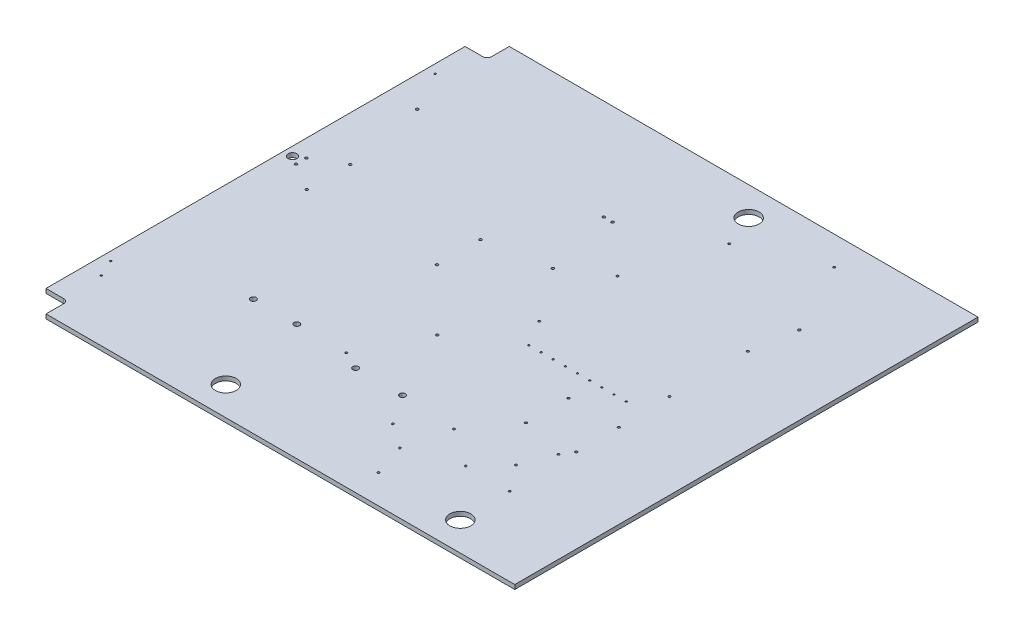
from build123d import *

# Parameters (mm, degrees)
SKETCH1_W                                   = 533.4
SKETCH1_H                                   = 5
BOSS_EXTRUDE1_DEPTH                         = 565.15
BOTTHOMHOLES_SKETCH2_R                      = 12
BOTTOMSTEPPERHOLES_CUT_EXTRUDE1_DEPTH       = 778.132602906
BOTTOMPSUHOLESSKETCH2_R                     = 1.5
BOTTOMPSUHOLESSKETCH2_R_2                   = 3.25
BOTTOMPSUHOLESCUT_EXTRUDE1_DEPTH            = 778.132602906
OCTOPUSHOLESSKETCH2_R                       = 1.35
OCTOPUSMOUNTHOLESCUT_EXTRUDE1_DEPTH         = 778.132602906
POWRCABLEGUIDEMOUNTHOLESSKETCH2_R           = 1.5
POWERCABLEGUIDEMOUNTHOLESCUT_EXTRUDE1_DEPTH = 778.132602906
RPIHOLESSKETCH2_R                           = 1.35
RPIMOUNTHOLESCUT_EXTRUDE1_DEPTH             = 778.132602906
CABLEHOLESSKETCH2_R                         = 1.5
CABLEHOLESSKETCH2_R_2                       = 5
CABLEHOLESSKETCH2_R_3                       = 1
CABLEHOLESCUT_EXTRUDE1_DEPTH                = 778.132602906
SKETCH2_R                                   = 1
OCTOPUSROUTING_HOLESCUT_EXTRUDE1_DEPTH      = 778.132602906
SKETCH3_R                                   = 1.25
CORNERCLAMPHOLECUTS_EXTRUDE1_DEPTH          = 778.132602906
CORNERCABLEKNOTCHCUT_EXTRUDE1_DEPTH         = 778.132602906


with BuildPart() as part:
    # Sketch1 → Boss-Extrude1 (new body)
    with BuildSketch(Plane(origin=(0, 0, 0), x_dir=(0, 0, -1), z_dir=(1, 0, 0))):
        with Locations((-266.7, 2.5)):
            Rectangle(SKETCH1_W, SKETCH1_H)
    extrude(amount=BOSS_EXTRUDE1_DEPTH)

    # BotthomHoles-Sketch2 → BottomStepperHoles-Cut-Extrude1 (cut, through all)
    with BuildSketch(Plane(origin=(0, 5, 0), x_dir=(1, 0, 0), z_dir=(0, 1, 0))):
        with Locations((334.275, -33.175)):
            Circle(BOTTHOMHOLES_SKETCH2_R)
        with Locations((199.275, -500.225)):
            Circle(BOTTHOMHOLES_SKETCH2_R)
        with Locations((469.275, -500.225)):
            Circle(BOTTHOMHOLES_SKETCH2_R)
    extrude(amount=-BOTTOMSTEPPERHOLES_CUT_EXTRUDE1_DEPTH, mode=Mode.SUBTRACT)

    # BottomPSUHolesSketch2 → BottomPSUHolesCut-Extrude1 (cut, through all)
    with BuildSketch(Plane(origin=(0, 5, 0), x_dir=(1, 0, 0), z_dir=(0, 1, 0))):
        with Locations((201.5, -209.2)):
            Circle(BOTTOMPSUHOLESSKETCH2_R)
        with Locations((201.5, -259.2)):
            Circle(BOTTOMPSUHOLESSKETCH2_R)
        with Locations((51.5, -209.2)):
            Circle(BOTTOMPSUHOLESSKETCH2_R)
        with Locations((51.5, -259.2)):
            Circle(BOTTOMPSUHOLESSKETCH2_R)
        with Locations((180, -399.2)):
            Circle(BOTTOMPSUHOLESSKETCH2_R_2)
        with Locations((130, -399.2)):
            Circle(BOTTOMPSUHOLESSKETCH2_R_2)
        with Locations((257.75, -409.2)):
            Circle(BOTTOMPSUHOLESSKETCH2_R_2)
        with Locations((311.75, -409.2)):
            Circle(BOTTOMPSUHOLESSKETCH2_R_2)
    extrude(amount=-BOTTOMPSUHOLESCUT_EXTRUDE1_DEPTH, mode=Mode.SUBTRACT)

    # OctopusHolesSketch2 → OctopusMountHolesCut-Extrude1 (cut, through all)
    with BuildSketch(Plane(origin=(0, 5, 0), x_dir=(1, 0, 0), z_dir=(0, 1, 0))):
        with Locations((316.75, -256.7)):
            Circle(OCTOPUSHOLESSKETCH2_R)
        with Locations((466.75, -256.7)):
            Circle(OCTOPUSHOLESSKETCH2_R)
        with Locations((316.75, -166.7)):
            Circle(OCTOPUSHOLESSKETCH2_R)
        with Locations((466.75, -166.7)):
            Circle(OCTOPUSHOLESSKETCH2_R)
    extrude(amount=-OCTOPUSMOUNTHOLESCUT_EXTRUDE1_DEPTH, mode=Mode.SUBTRACT)

    # PowrCableGuideMountHolesSketch2 → PowerCableGuideMountHolesCut-Extrude1 (cut, through all)
    with BuildSketch(Plane(origin=(0, 5, 0), x_dir=(1, 0, 0), z_dir=(0, 1, 0))):
        with Locations((271.75, -329.2)):
            Circle(POWRCABLEGUIDEMOUNTHOLESSKETCH2_R)
        with Locations((271.75, -196.2)):
            Circle(POWRCABLEGUIDEMOUNTHOLESSKETCH2_R)
    extrude(amount=-POWERCABLEGUIDEMOUNTHOLESCUT_EXTRUDE1_DEPTH, mode=Mode.SUBTRACT)

    # RPIHolesSketch2 → RPIMountHolesCut-Extrude1 (cut, through all)
    with BuildSketch(Plane(origin=(0, 5, 0), x_dir=(1, 0, 0), z_dir=(0, 1, 0))):
        with Locations((468.25, -316.7)):
            Circle(RPIHOLESSKETCH2_R)
        with Locations((468.25, -365.7)):
            Circle(RPIHOLESSKETCH2_R)
        with Locations((410.25, -316.7)):
            Circle(RPIHOLESSKETCH2_R)
        with Locations((410.25, -365.7)):
            Circle(RPIHOLESSKETCH2_R)
    extrude(amount=-RPIMOUNTHOLESCUT_EXTRUDE1_DEPTH, mode=Mode.SUBTRACT)

    # CableHolesSketch2 → CableHolesCut-Extrude1 (cut, through all)
    with BuildSketch(Plane(origin=(0, 5, 0), x_dir=(1, 0, 0), z_dir=(0, 1, 0))):
        with Locations((260, -115.65)):
            Circle(CABLEHOLESSKETCH2_R)
        with Locations((10, -234.2)):
            Circle(CABLEHOLESSKETCH2_R_2)
        with Locations((19, -463.4)):
            Circle(CABLEHOLESSKETCH2_R_3)
        with Locations((10, -70)):
            Circle(CABLEHOLESSKETCH2_R_3)
        with Locations((10, -443.4)):
            Circle(CABLEHOLESSKETCH2_R_3)
        with Locations((475, -115.65)):
            Circle(CABLEHOLESSKETCH2_R)
        with Locations((250, -115.65)):
            Circle(CABLEHOLESSKETCH2_R)
        with Locations((35, -115.65)):
            Circle(CABLEHOLESSKETCH2_R)
        with Locations((20, -240.2)):
            Circle(CABLEHOLESSKETCH2_R)
        with Locations((20, -228.2)):
            Circle(CABLEHOLESSKETCH2_R)
    extrude(amount=-CABLEHOLESCUT_EXTRUDE1_DEPTH, mode=Mode.SUBTRACT)

    # Sketch2 → OctopusRouting holesCut-Extrude1 (cut, through all)
    with BuildSketch(Plane(origin=(0, 5, 0), x_dir=(1, 0, 0), z_dir=(0, 1, 0))):
        with Locations((334.75, -286.7)):
            Circle(SKETCH2_R)
        with Locations((348.75, -286.7)):
            Circle(SKETCH2_R)
        with Locations((362.75, -286.7)):
            Circle(SKETCH2_R)
        with Locations((376.75, -286.7)):
            Circle(SKETCH2_R)
        with Locations((390.75, -286.7)):
            Circle(SKETCH2_R)
        with Locations((404.75, -286.7)):
            Circle(SKETCH2_R)
        with Locations((418.75, -286.7)):
            Circle(SKETCH2_R)
        with Locations((432.75, -286.7)):
            Circle(SKETCH2_R)
        with Locations((446.75, -286.7)):
            Circle(SKETCH2_R)
    extrude(amount=-OCTOPUSROUTING_HOLESCUT_EXTRUDE1_DEPTH, mode=Mode.SUBTRACT)

    # Sketch3 → CornerClampHoleCuts-Extrude1 (cut, through all)
    with BuildSketch(Plane(origin=(0, 5, 0), x_dir=(1, 0, 0), z_dir=(0, 1, 0))):
        with Locations((469.275, -443.4)):
            Circle(SKETCH3_R)
        with Locations((418.75, -443.4)):
            Circle(SKETCH3_R)
        with Locations((446.75, -413.4)):
            Circle(SKETCH3_R)
        with Locations((375, -413.4)):
            Circle(SKETCH3_R)
        with Locations((375, -500.225)):
            Circle(SKETCH3_R)
        with Locations((362.75, -463.4)):
            Circle(SKETCH3_R)
        with Locations((334.75, -443.4)):
            Circle(SKETCH3_R)
        with Locations((432.75, -33.175)):
            Circle(SKETCH3_R)
        with Locations((348.75, -70)):
            Circle(SKETCH3_R)
        with Locations((237, -399.2)):
            Circle(SKETCH3_R)
        with Locations((460.5, -378.4)):
            Circle(SKETCH3_R)
    extrude(amount=-CORNERCLAMPHOLECUTS_EXTRUDE1_DEPTH, mode=Mode.SUBTRACT)

    # CornerCableKnotchesSketch4 → CornerCableKnotchCut-Extrude1 (cut, through all)
    with BuildSketch(Plane(origin=(0, 5, 0), x_dir=(1, 0, 0), z_dir=(0, 1, 0))):
        with BuildLine():
            Line((0, -25.4), (20.4, -25.4))
            ThreePointArc((20.4, -25.4), (23.935533906, -23.935533906), (25.4, -20.4))
            Line((25.4, -20.4), (25.4, 0))
            Line((25.4, 0), (0, 0))
            Line((0, 0), (0, -25.4))
        make_face()
        with BuildLine():
            Line((0, -508), (20.4, -508))
            ThreePointArc((20.4, -508), (23.935533906, -509.464466094), (25.4, -513))
            Line((25.4, -513), (25.4, -533.4))
            Line((25.4, -533.4), (0, -533.4))
            Line((0, -533.4), (0, -508))
        make_face()
    extrude(amount=-CORNERCABLEKNOTCHCUT_EXTRUDE1_DEPTH, mode=Mode.SUBTRACT)


solid = part.part
